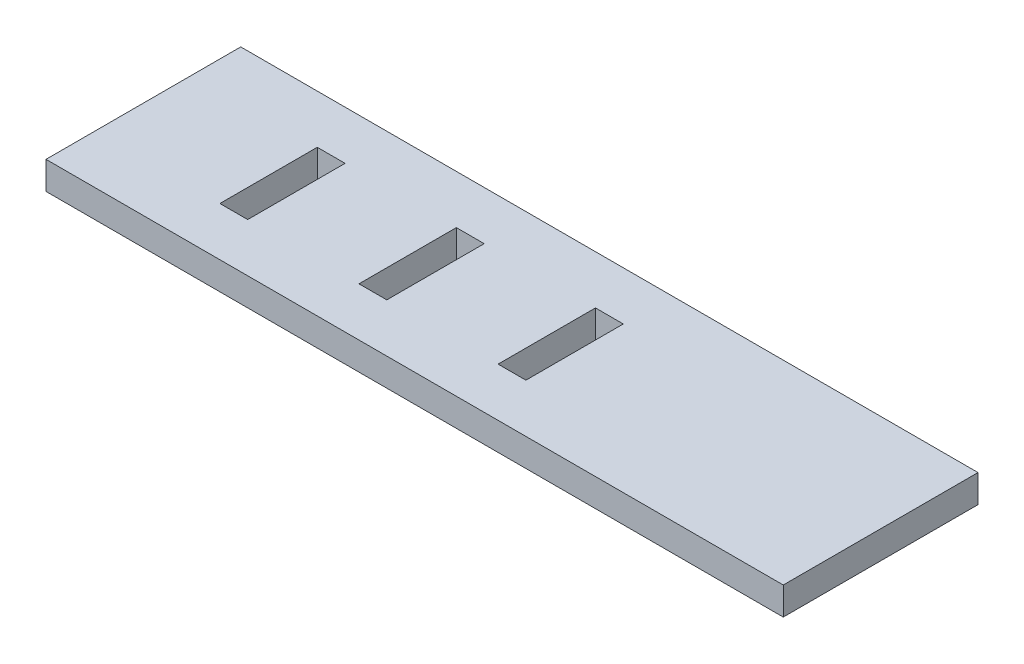
from build123d import *

# Parameters (mm, degrees)
SKETCH1_W           = 265
SKETCH1_H           = 70
SKETCH1_W_2         = 10
SKETCH1_H_2         = 35
BOSS_EXTRUDE1_DEPTH = 10


with BuildPart() as part:
    # Sketch1 → Boss-Extrude1 (new body)
    with BuildSketch(Plane(origin=(0, 0, 0), x_dir=(1, 0, 0), z_dir=(0, 1, 0))):
        with Locations((34.075342466, 5.993150685)):
            Rectangle(SKETCH1_W, SKETCH1_H)
        with Locations((-48.424657534, 5.993150685)):
            Rectangle(SKETCH1_W_2, SKETCH1_H_2, mode=Mode.SUBTRACT)
        with Locations((1.575342466, 5.993150685)):
            Rectangle(SKETCH1_W_2, SKETCH1_H_2, mode=Mode.SUBTRACT)
        with Locations((51.575342466, 5.993150685)):
            Rectangle(SKETCH1_W_2, SKETCH1_H_2, mode=Mode.SUBTRACT)
    extrude(amount=BOSS_EXTRUDE1_DEPTH)


solid = part.part
